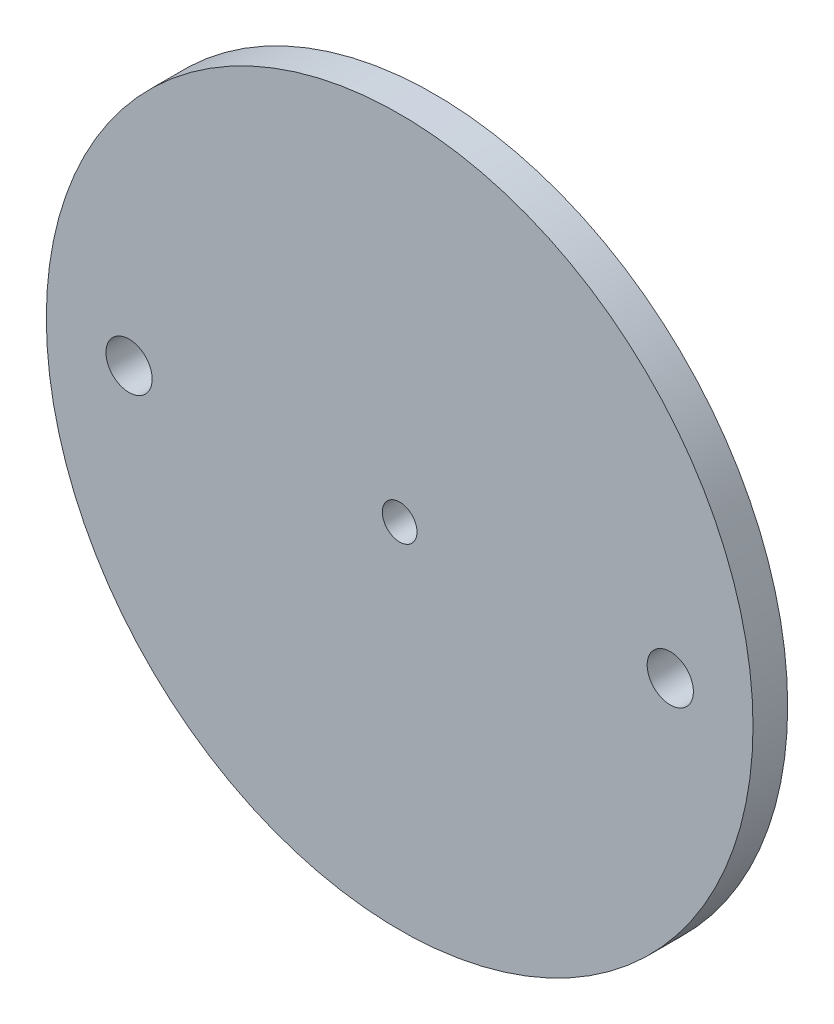
from build123d import *

# Parameters (mm, degrees)
SKETCH1_R           = 48.5394
BOSS_EXTRUDE1_DEPTH = 4.7625
SKETCH2_R           = 2.38125
SKETCH2_R_2         = 3.175
CUT_EXTRUDE1_DEPTH  = 69.810087276


with BuildPart() as part:
    # Sketch1 → Boss-Extrude1 (new body)
    with BuildSketch(Plane.XY):
        Circle(SKETCH1_R)
    extrude(amount=BOSS_EXTRUDE1_DEPTH)

    # Sketch2 → Cut-Extrude1 (cut, through all)
    with BuildSketch(Plane.XY.offset(4.7625)):
        Circle(SKETCH2_R)
        with Locations((37.1729, 0)):
            Circle(SKETCH2_R_2)
        with Locations((-37.1729, 0)):
            Circle(SKETCH2_R_2)
    extrude(amount=-CUT_EXTRUDE1_DEPTH, mode=Mode.SUBTRACT)


solid = part.part
